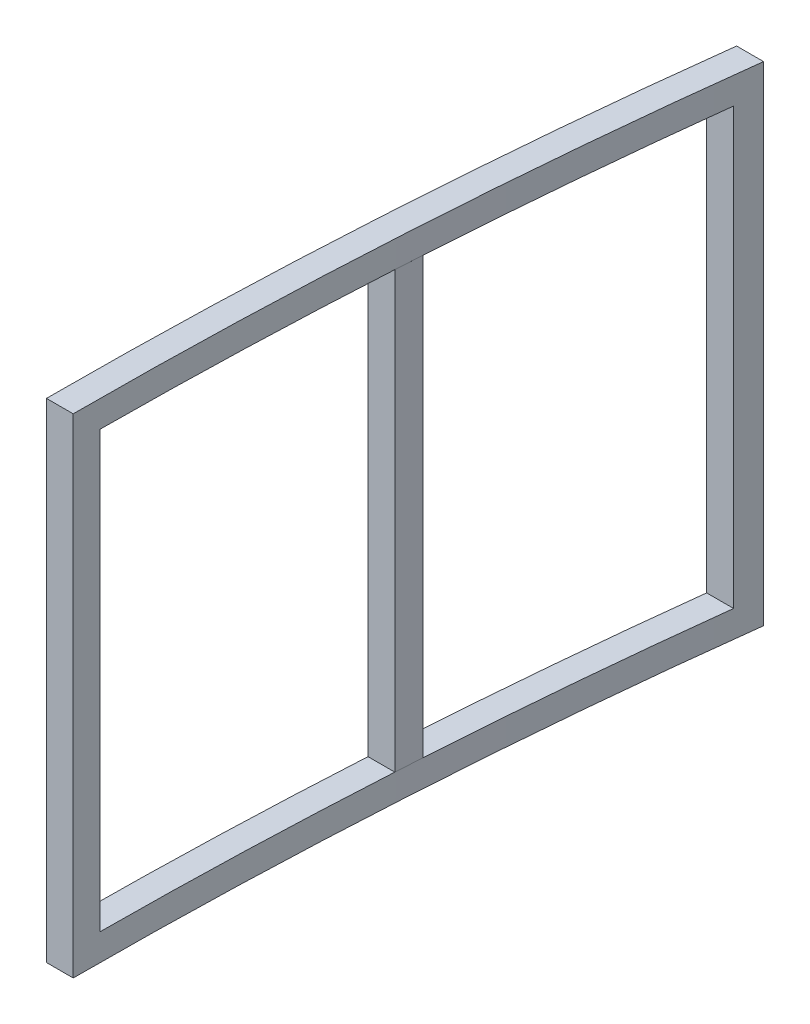
from build123d import *

# Parameters (mm, degrees)
BOSS_EXTRUDE1_DEPTH = 914.4
SKETCH2_W           = 1116.884471925
SKETCH2_H           = 814.4
CUT_EXTRUDE1_DEPTH  = 19950.853735504
BOSS_EXTRUDE3_DEPTH = 814.4


with BuildPart() as part:
    # Sketch1 → Boss-Extrude1 (new body)
    with BuildSketch(Plane(origin=(0, 0, 0), x_dir=(1, 0, 0), z_dir=(0, 1, 0))):
        with BuildLine():
            Line((-9820.644594144, 1216.884471925), (-9871.125792152, 1216.884471925))
            ThreePointArc((-9871.125792152, 1216.884471925), (-9927.151370921, 609.588288366), (-9945.85, 0))
            Line((-9945.85, 0), (-9895.75, 0))
            ThreePointArc((-9895.75, 0), (-9876.955801384, 609.6), (-9820.644594144, 1216.884471925))
        make_face()
    extrude(amount=BOSS_EXTRUDE1_DEPTH)

    # Sketch2 → Cut-Extrude1 (cut, through all)
    with BuildSketch(Plane(origin=(9945.85, 0, 0), x_dir=(0, 0, -1), z_dir=(1, 0, 0))):
        with Locations((608.442235963, 457.2)):
            Rectangle(SKETCH2_W, SKETCH2_H)
    extrude(amount=-CUT_EXTRUDE1_DEPTH, mode=Mode.SUBTRACT)

    # Sketch5 → Boss-Extrude3 (add)
    with BuildSketch(Plane.XZ.offset(-864.4)):
        Polygon((-9925.583865068, -634.6), (-9875.381051003, -634.6), (-9878.46703201, -584.6), (-9928.654242268, -584.6), align=None)
    extrude(amount=BOSS_EXTRUDE3_DEPTH)


solid = part.part
